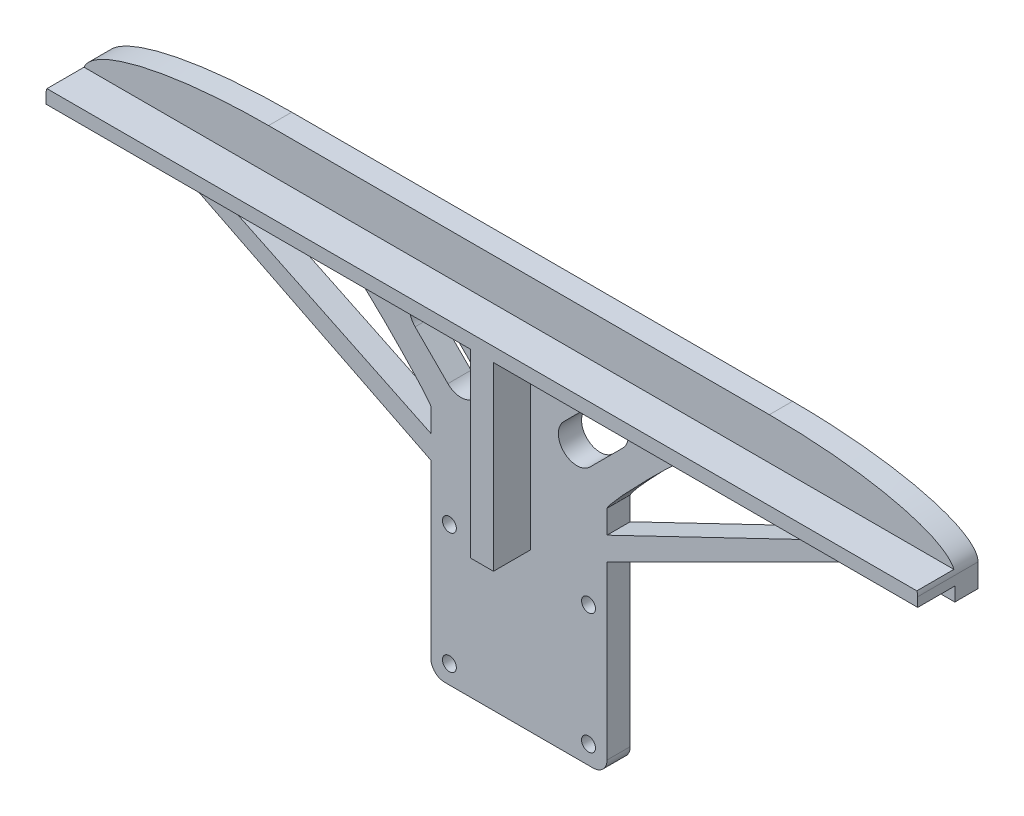
from build123d import *

# Parameters (mm, degrees)
SKETCH1_W           = 38
SKETCH1_H           = 70
BOSS_EXTRUDE1_DEPTH = 5
SKETCH2_R           = 1.5
CUT_EXTRUDE1_DEPTH  = 134.018795664
FILLET1_R           = 3
FILLET2_DEPTH       = 5
SKETCH3_W           = 188
SKETCH3_H           = 3
BOSS_EXTRUDE2_DEPTH = 8
SKETCH4_W           = 5
SKETCH4_H           = 39
BOSS_EXTRUDE3_DEPTH = 8
BOSS_EXTRUDE4_DEPTH = 5
FILLET3_SIZE        = 40
FILLET3_SIZE_2      = 10
FILLET4_SIZE        = 40
FILLET4_SIZE_2      = 10
CUT_EXTRUDE2_DEPTH  = 134.165310942


with BuildPart() as part:
    # Sketch1 → Boss-Extrude1 (new body)
    with BuildSketch(Plane.XY):
        with Locations((19, -35)):
            Rectangle(SKETCH1_W, SKETCH1_H)
        Polygon((-75, 15), (-75, 0), (0, 0), (38, 0), (113, 0), (113, 15), align=None)
    extrude(amount=BOSS_EXTRUDE1_DEPTH)

    # Sketch2 → Cut-Extrude1 (cut, through all)
    with BuildSketch(Plane.XY.offset(5)):
        with Locations((34, -66)):
            Circle(SKETCH2_R)
        with Locations((4, -66)):
            Circle(SKETCH2_R)
        with Locations((4, -40)):
            Circle(SKETCH2_R)
        with Locations((34, -40)):
            Circle(SKETCH2_R)
    extrude(amount=-CUT_EXTRUDE1_DEPTH, mode=Mode.SUBTRACT)

    # Fillet1
    fillet1_edges = [part.edges().sort_by_distance(p)[0] for p in [
        (38, -70, 2.5),
        (0, -70, 2.5),
    ]]
    fillet(fillet1_edges, radius=FILLET1_R)

    # Fillet2: read off the stored shape, not the designer's step
    # Fillet2 outline → Fillet2 (add)
    with BuildSketch(Plane.XY):
        with BuildLine():
            add(Edge.make_bspline(
                [(58, 0), (38, 0), (38, -20)],
                knots=[0, 0, 0, 1, 1, 1], degree=2, weights=[1, 0.052631579, 1]))
            Line((58, 0), (38, 0))
            Line((38, 0), (38, -20))
        make_face()
        with BuildLine():
            Line((0, 0), (-20, 0))
            add(Edge.make_bspline(
                [(-20, 0), (0, 0), (0, -20)],
                knots=[0, 0, 0, 1, 1, 1], degree=2, weights=[1, 0.052631579, 1]))
            Line((0, -20), (0, 0))
        make_face()
    extrude(amount=FILLET2_DEPTH)

    # Sketch3 → Boss-Extrude2 (add)
    with BuildSketch(Plane.XY.offset(5)):
        with Locations((19, 4.5)):
            Rectangle(SKETCH3_W, SKETCH3_H)
    extrude(amount=BOSS_EXTRUDE2_DEPTH)

    # Sketch4 → Boss-Extrude3 (add)
    with BuildSketch(Plane.XY.offset(5)):
        with Locations((19, -16.5)):
            Rectangle(SKETCH4_W, SKETCH4_H)
    extrude(amount=BOSS_EXTRUDE3_DEPTH)

    # Sketch5 → Boss-Extrude4 (add)
    with BuildSketch(Plane.XY.offset(5)):
        Polygon((-52, 0), (-57.902965871, 0), (-60, 0), (0, -30), (0, -25), align=None)
        Polygon((38, -30), (98, 0), (90, 0), (38, -25), align=None)
    extrude(amount=-BOSS_EXTRUDE4_DEPTH)

    # Fillet3
    # a fillet whose section is not a circle: 40, 10 mm, written as the material it takes off along each edge
    with BuildSketch(Plane(origin=(-75, 15, -100), x_dir=(1, 0, 0), z_dir=(0, 0, 1))) as fillet3_piece_1:
        with BuildLine():
            Bezier((FILLET3_SIZE, 0), (0, 0), (0, -FILLET3_SIZE_2), weights=[1, 0.707106781, 1])
            Line((0, -FILLET3_SIZE_2), (0, 0))
            Line((0, 0), (FILLET3_SIZE, 0))
        make_face()
    extrude(amount=205, mode=Mode.SUBTRACT)

    # Fillet4
    # a fillet whose section is not a circle: 40, 10 mm, written as the material it takes off along each edge
    with BuildSketch(Plane(origin=(113, 15, -100), x_dir=(-1, 0, 0), z_dir=(0, 0, 1))) as fillet4_piece_1:
        with BuildLine():
            Bezier((FILLET4_SIZE, 0), (0, 0), (0, FILLET4_SIZE_2), weights=[1, 0.707106781, 1])
            Line((0, FILLET4_SIZE_2), (0, 0))
            Line((0, 0), (FILLET4_SIZE, 0))
        make_face()
    extrude(amount=205, mode=Mode.SUBTRACT)

    # Sketch6 → Cut-Extrude2 (cut, through all)
    with BuildSketch(Plane.XY.offset(5)):
        with BuildLine():
            Line((3.671572875, -13.862410437), (-3.399494937, -6.791342626))
            ThreePointArc((-3.399494937, -6.791342626), (-3.399494937, -1.134488376), (2.257359313, -1.134488376))
            Line((2.257359313, -1.134488376), (9.328427125, -8.205556188))
            ThreePointArc((9.328427125, -8.205556188), (9.328427125, -13.862410437), (3.671572875, -13.862410437))
        make_face()
        with BuildLine():
            Line((28.671572875, -8.445013015), (35.742640687, -1.373945203))
            ThreePointArc((35.742640687, -1.373945203), (41.399494937, -1.373945203), (41.399494937, -7.030799453))
            Line((41.399494937, -7.030799453), (34.328427125, -14.101867265))
            ThreePointArc((34.328427125, -14.101867265), (28.671572875, -14.101867265), (28.671572875, -8.445013015))
        make_face()
    extrude(amount=-CUT_EXTRUDE2_DEPTH, mode=Mode.SUBTRACT)


solid = part.part
